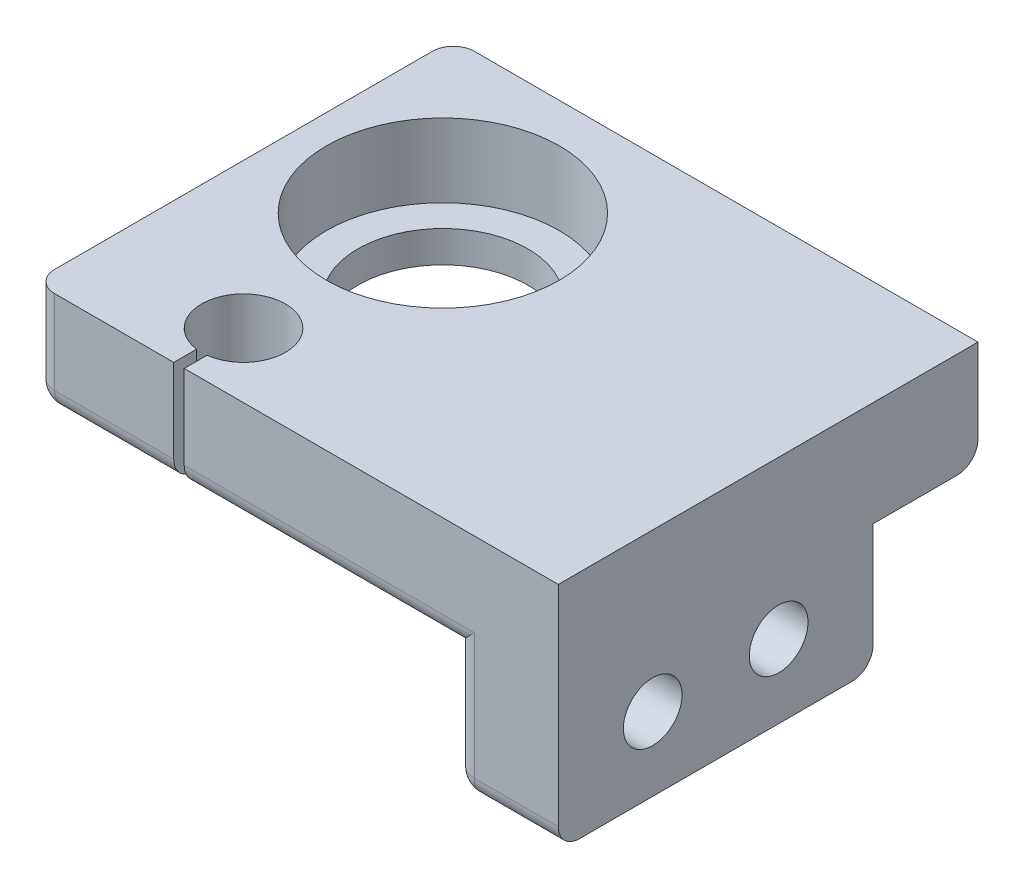
from build123d import *

# Parameters (mm, degrees)
SKETCH1_R           = 8.1
BOSS_EXTRUDE1_DEPTH = 10
SKETCH2_R           = 11.1
CUT_EXTRUDE1_DEPTH  = 7
SKETCH6_W           = 10
SKETCH6_H           = 12
BOSS_EXTRUDE3_DEPTH = 30
SKETCH7_R           = 2.8
CUT_EXTRUDE2_DEPTH  = 58.827329179
SKETCH8_R           = 4.3
CUT_EXTRUDE3_DEPTH  = 6
FILLET1_R           = 2


with BuildPart() as part:
    # Sketch1 → Boss-Extrude1 (new body)
    with BuildSketch(Plane(origin=(0, 0, 0), x_dir=(1, 0, 0), z_dir=(0, 1, 0))):
        with BuildLine():
            Line((50, 0), (0, 0))
            Line((0, 0), (0, -40))
            Line((0, -40), (13.35, -40))
            Line((13.35, -40), (13.35, -37.818626967))
            ThreePointArc((13.35, -37.818626967), (11.204248689, -30.85), (17.85, -33.85))
            ThreePointArc((17.85, -33.85), (16.85, -36.495751311), (14.35, -37.818626967))
            Line((14.35, -37.818626967), (14.35, -40))
            Line((14.35, -40), (50, -40))
            Line((50, -40), (50, 0))
        make_face()
        with Locations((13.85, -14.85)):
            Circle(SKETCH1_R, mode=Mode.SUBTRACT)
    extrude(amount=BOSS_EXTRUDE1_DEPTH)

    # Sketch2 → Cut-Extrude1 (cut)
    with BuildSketch(Plane(origin=(0, 10, 0), x_dir=(1, 0, 0), z_dir=(0, 1, 0))):
        with Locations((13.85, -14.85)):
            Circle(SKETCH2_R)
    extrude(amount=-CUT_EXTRUDE1_DEPTH, mode=Mode.SUBTRACT)

    # Sketch6 → Boss-Extrude3 (add)
    with BuildSketch(Plane.XY.offset(40)):
        with Locations((45, -6)):
            Rectangle(SKETCH6_W, SKETCH6_H)
    extrude(amount=-BOSS_EXTRUDE3_DEPTH)

    # Sketch7 → Cut-Extrude2 (cut, through all)
    with BuildSketch(Plane.ZY.offset(-40)):
        with Locations((19, -5)):
            Circle(SKETCH7_R)
        with Locations((31, -5)):
            Circle(SKETCH7_R)
    extrude(amount=-CUT_EXTRUDE2_DEPTH, mode=Mode.SUBTRACT)

    # Sketch8 → Cut-Extrude3 (cut)
    with BuildSketch(Plane.ZY.offset(-40)):
        with Locations((19, -5)):
            Circle(SKETCH8_R)
        with Locations((31, -5)):
            Circle(SKETCH8_R)
    extrude(amount=-CUT_EXTRUDE3_DEPTH, mode=Mode.SUBTRACT)

    # Fillet1
    fillet1_edges = [part.edges().sort_by_distance(p)[0] for p in [
        (45, -12, 10),
        (45, -12, 40),
        (6.675, 0, 40),
        (27.175, 0, 40),
        (40, -6, 40),
        (40, -12, 25),
        (40, -6, 10),
        (0, 5, 40),
        (0, 5, 0),
        (25, 0, 0),
        (0, 0, 20),
    ]]
    fillet(fillet1_edges, radius=FILLET1_R)


solid = part.part
